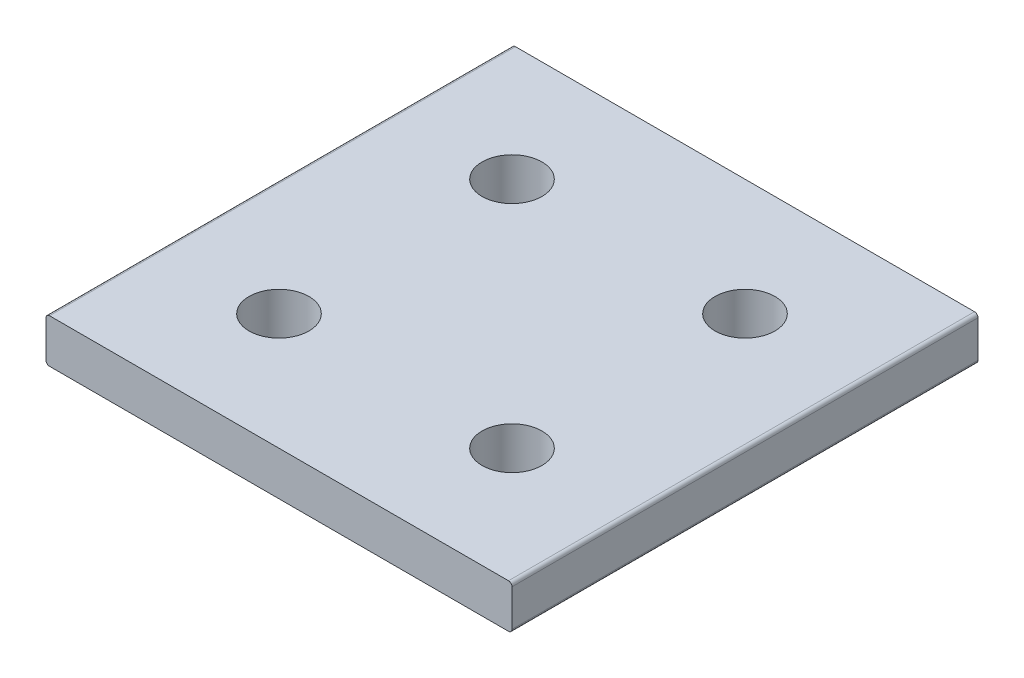
from build123d import *

# Parameters (mm, degrees)
BOSS_EXTRUDE1_OUTLINE_W  = 4.7752
BOSS_EXTRUDE1_OUTLINE_H  = 50.8
BOSS_EXTRUDE1_DEPTH      = 50.8
F_0_257_DIAMETER_HOLE1_D = 6.5278
FILLET1_R                = 0.381
LPATTERN1_COUNT          = 2
LPATTERN1_PITCH          = 25.4
LPATTERN1_COUNT_DIR2     = 2
LPATTERN1_PITCH_DIR2     = 25.4


# Read off the part's stored shape, not the designer's step: Boss-Extrude1
with BuildPart() as part:
    # Boss-Extrude1 outline → Boss-Extrude1 (new body)
    with BuildSketch(Plane.YZ):
        with Locations((2.3876, 25.4)):
            Rectangle(BOSS_EXTRUDE1_OUTLINE_W, BOSS_EXTRUDE1_OUTLINE_H)
    extrude(amount=BOSS_EXTRUDE1_DEPTH)

    # F (0.257) Diameter Hole1 (through all)
    with Locations(Plane(origin=(0, 4.7752, 0), x_dir=(1, 0, 0), z_dir=(0, 1, 0))):
        with Locations((38.1, -38.1)):
            f_0_257_diameter_hole1 = Hole(F_0_257_DIAMETER_HOLE1_D / 2)

    # Fillet1
    fillet1_edges = [part.edges().sort_by_distance(p)[0] for p in [
        (50.8, 4.7752, 25.4),
        (0, 4.7752, 25.4),
        (50.8, 0, 25.4),
        (0, 0, 25.4),
    ]]
    fillet(fillet1_edges, radius=FILLET1_R)

    # LPattern1: F _0.257_ Diameter Hole1 2 × 2
    with Locations(*[(-i * LPATTERN1_PITCH, 0, -j * LPATTERN1_PITCH_DIR2) for i in range(LPATTERN1_COUNT) for j in range(LPATTERN1_COUNT_DIR2) if (i, j) != (0, 0)]):
        add(f_0_257_diameter_hole1, mode=Mode.SUBTRACT)


solid = part.part
